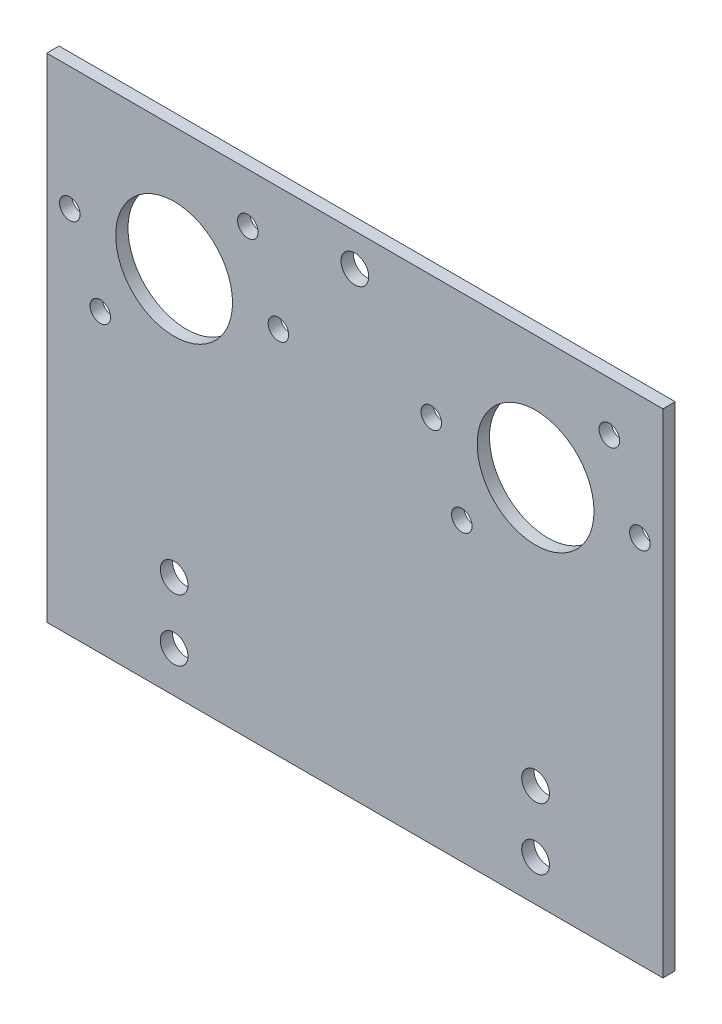
from build123d import *

# Parameters (mm, degrees)
SKETCH1_W           = 150
SKETCH1_H           = 120
BOSS_EXTRUDE1_DEPTH = 3
SKETCH2_R           = 14.225
SKETCH2_R_2         = 3.375
CUT_EXTRUDE1_DEPTH  = 193.117151759
SKETCH3_R           = 2.0193
CUT_EXTRUDE2_DEPTH  = 193.117151759
SKETCH6_R           = 2.5
CUT_EXTRUDE3_DEPTH  = 193.117151759


with BuildPart() as part:
    # Sketch1 → Boss-Extrude1 (new body)
    with BuildSketch(Plane.XY):
        with Locations((75, -60)):
            Rectangle(SKETCH1_W, SKETCH1_H)
    extrude(amount=BOSS_EXTRUDE1_DEPTH)

    # Sketch2 → Cut-Extrude1 (cut, through all)
    with BuildSketch(Plane.XY.offset(3)):
        with Locations((31, -30)):
            Circle(SKETCH2_R)
        with Locations((119, -30)):
            Circle(SKETCH2_R)
        with Locations((31, -110)):
            Circle(SKETCH2_R_2)
        with Locations((119, -110)):
            Circle(SKETCH2_R_2)
        with Locations((75, -8)):
            Circle(SKETCH2_R_2)
        with Locations((31, -95)):
            Circle(SKETCH2_R_2)
        with Locations((119, -95)):
            Circle(SKETCH2_R_2)
    extrude(amount=-CUT_EXTRUDE1_DEPTH, mode=Mode.SUBTRACT)

    # Sketch3 → Cut-Extrude2 (cut, through all)
    with BuildSketch(Plane(origin=(0, 0, 0), x_dir=(-1, 0, 0), z_dir=(0, 0, -1))):
        with Locations((-13.039487758, -47.960512242)):
            Circle(SKETCH3_R)
        with Locations((-56.4, -30)):
            Circle(SKETCH3_R)
        with Locations((-48.960512242, -12.039487758)):
            Circle(SKETCH3_R)
        with Locations((-5.6, -30)):
            Circle(SKETCH3_R)
        with Locations((-136.960512242, -12.039487758)):
            Circle(SKETCH3_R)
        with Locations((-144.4, -30)):
            Circle(SKETCH3_R)
        with Locations((-93.6, -30)):
            Circle(SKETCH3_R)
        with Locations((-101.039487758, -47.960512242)):
            Circle(SKETCH3_R)
    extrude(amount=-CUT_EXTRUDE2_DEPTH, mode=Mode.SUBTRACT)

    # Sketch6 → Cut-Extrude3 (cut, through all)
    with BuildSketch(Plane.XY.offset(3)):
        with Locations((5.6, -30)):
            Circle(SKETCH6_R)
        with Locations((13.039487758, -47.960512242)):
            Circle(SKETCH6_R)
        with Locations((56.4, -30)):
            Circle(SKETCH6_R)
        with Locations((48.960512242, -12.039487758)):
            Circle(SKETCH6_R)
        with Locations((101.039487758, -47.960512242)):
            Circle(SKETCH6_R)
        with Locations((93.6, -30)):
            Circle(SKETCH6_R)
        with Locations((136.960512242, -12.039487758)):
            Circle(SKETCH6_R)
        with Locations((144.4, -30)):
            Circle(SKETCH6_R)
    extrude(amount=-CUT_EXTRUDE3_DEPTH, mode=Mode.SUBTRACT)


solid = part.part
